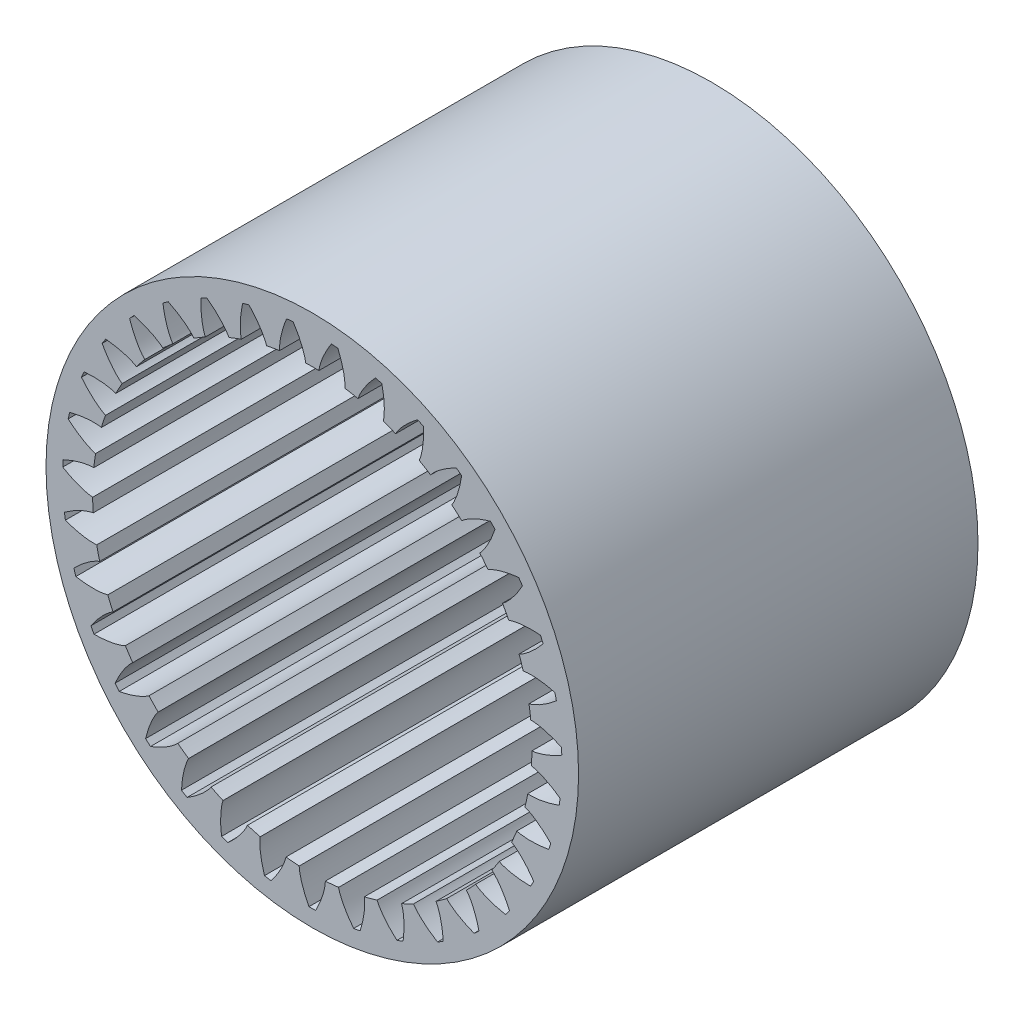
from build123d import *

# Parameters (mm, degrees)
SKETCH_1_R               = 21.000000003
SKETCH_1_R_2             = 18.75
EXTRUDE_1_DEPTH          = 30
EXTRUDE_2_DEPTH          = 30
PATTERN_CIRCULAR_1_COUNT = 35
CUT_EXTRUDE_START        = -115
SKETCH_4_R               = 21.000000003
SKETCH_4_R_2             = 20
CUT_EXTRUDE_1_DEPTH      = 115


with BuildPart() as part:
    # 草图1 → 凸台-拉伸1 (new body)
    with BuildSketch(Plane.XY):
        Circle(SKETCH_1_R)
        Circle(SKETCH_1_R_2, mode=Mode.SUBTRACT)
    extrude(amount=EXTRUDE_1_DEPTH)

    # 草图2 → 凸台-拉伸2 (add)
    with BuildSketch(Plane.XY):
        with BuildLine():
            ThreePointArc((0.497528276, 16.492249752), (0, 16.499752613), (-0.497528276, 16.492249752))
            add(Edge.make_bspline(
                [(-0.497528276, 16.492249752), (-0.501689381, 16.528841306), (-0.509610557, 16.581746441), (-0.522741704, 16.652877668), (-0.534117381, 16.708278915), (-0.548045975, 16.769858498), (-0.564779514, 16.83753379), (-0.584566449, 16.911214715), (-0.607653089, 16.990803663), (-0.634282891, 17.076195601), (-0.664696418, 17.167278134), (-0.699131094, 17.263931585), (-0.737821023, 17.36602907), (-0.780996792, 17.473436591), (-0.828885283, 17.586013122), (-0.881709483, 17.703610707), (-0.939688297, 17.82607456), (-1.003036366, 17.953243169), (-1.071963886, 18.084948407), (-1.146676426, 18.221015645), (-1.22737477, 18.361263871), (-1.314254669, 18.505505815), (-1.440928446, 18.706606141), (-1.542347626, 18.857212405), (-1.613126281, 18.958068906)],
                knots=[0, 0, 0, 0, 0.040469637, 0.058779876, 0.079500094, 0.102630291, 0.128170467, 0.156120621, 0.186480754, 0.219250866, 0.254430957, 0.292021026, 0.332021075, 0.374431102, 0.419251108, 0.466481092, 0.516121056, 0.568170998, 0.622630919, 0.679500819, 0.738780698, 0.800470555, 0.864570391, 1, 1, 1, 1], degree=3))
            ThreePointArc((-1.613126281, 18.958068906), (0, 19.026574917), (1.613126281, 18.958068906))
            add(Edge.make_bspline(
                [(0.497528276, 16.492249752), (0.501689381, 16.528841306), (0.509610557, 16.581746441), (0.522741704, 16.652877668), (0.534117381, 16.708278915), (0.548045975, 16.769858498), (0.564779514, 16.83753379), (0.584566449, 16.911214715), (0.607653089, 16.990803663), (0.634282891, 17.076195601), (0.664696418, 17.167278134), (0.699131094, 17.263931585), (0.737821023, 17.36602907), (0.780996792, 17.473436591), (0.828885283, 17.586013122), (0.881709483, 17.703610707), (0.939688297, 17.82607456), (1.003036366, 17.953243169), (1.071963886, 18.084948407), (1.146676426, 18.221015645), (1.22737477, 18.361263871), (1.314254669, 18.505505815), (1.440928446, 18.706606141), (1.542347626, 18.857212405), (1.613126281, 18.958068906)],
                knots=[0, 0, 0, 0, 0.040469637, 0.058779876, 0.079500094, 0.102630291, 0.128170467, 0.156120621, 0.186480754, 0.219250866, 0.254430957, 0.292021026, 0.332021075, 0.374431102, 0.419251108, 0.466481092, 0.516121056, 0.568170998, 0.622630919, 0.679500819, 0.738780698, 0.800470555, 0.864570391, 1, 1, 1, 1], degree=3))
        make_face()
    extrude_2 = extrude(amount=EXTRUDE_2_DEPTH)

    # 阵列(圆周)1: 凸台-拉伸2 ×35 about axis
    pattern_circular_1_axis = Axis((0, 0, -1.5), (0, 0, 1))
    for i in range(1, PATTERN_CIRCULAR_1_COUNT):
        add(extrude_2.rotate(pattern_circular_1_axis, i * 360 / PATTERN_CIRCULAR_1_COUNT))

    # 草图4 → 切除-拉伸1 (cut)
    with BuildSketch(Plane.XY.offset(30).offset(CUT_EXTRUDE_START)):
        Circle(SKETCH_4_R)
        Circle(SKETCH_4_R_2, mode=Mode.SUBTRACT)
    extrude(amount=CUT_EXTRUDE_1_DEPTH, mode=Mode.SUBTRACT)


solid = part.part
